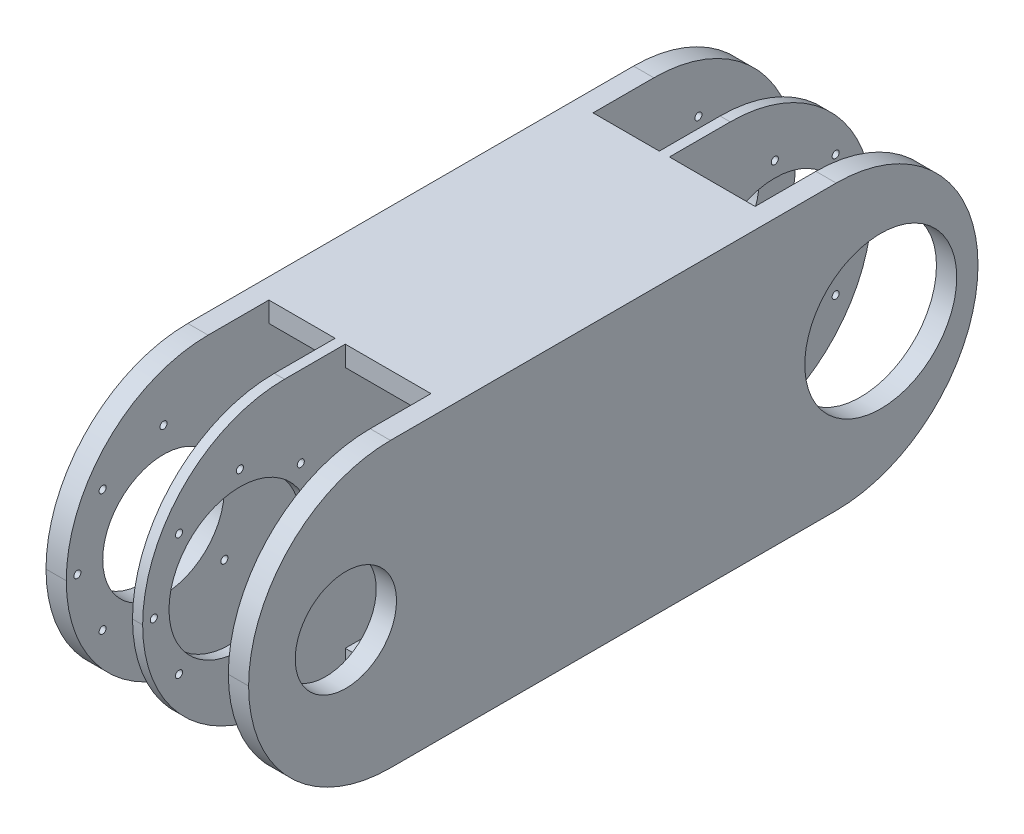
from build123d import *

# Parameters (mm, degrees)
SKETCH_1_W           = 42.3
SKETCH_1_H           = 10
EXTRUDE_3_DEPTH      = 240
SKETCH_2_W           = 42.3
SKETCH_2_H           = 140
CUT_EXTRUDE_1_DEPTH  = 100
SKETCH_3_W           = 42.7
SKETCH_3_H           = 240
EXTRUDE_4_DEPTH      = 140
CUT_EXTRUDE_2_REACH  = 287.139
SKETCH_4_W           = 32.7
SKETCH_4_H           = 120
SKETCH_7_W           = 32.7
SKETCH_7_H           = 140
CUT_EXTRUDE_6_DEPTH  = 100
FILLET_2_R           = 70
SKETCH_6_R           = 35
SKETCH_6_R_2         = 1.75
CUT_EXTRUDE_7_DEPTH  = 10
SKETCH_5_R           = 30
SKETCH_5_R_2         = 1.75
CUT_EXTRUDE_8_DEPTH  = 10
SKETCH_8_W           = 10
SKETCH_8_H           = 140
EXTRUDE_5_DEPTH      = 110
FILLET_4_R           = 60
SKETCH_17_R          = 25
CUT_EXTRUDE_13_DEPTH = 139
CUT_EXTRUDE_14_DEPTH = 110
SKETCH_19_R          = 37.5
CUT_EXTRUDE_15_DEPTH = 14


with BuildPart() as part:
    # 草图1 → 凸台-拉伸3 (new body)
    with BuildSketch(Plane.XY):
        with Locations((-15.094230769, 5.936538462)):
            Rectangle(SKETCH_1_W, SKETCH_1_H)
        Polygon((-36.244230769, 0.936538462), (-36.244230769, 10.936538462), (-41.244230769, 10.936538462), (-41.244230769, -129.063461538), (-36.244230769, -129.063461538), (-36.244230769, -119.063461538), align=None)
        Polygon((16.055769231, 10.936538462), (6.055769231, 10.936538462), (6.055769231, 0.936538462), (6.055769231, -119.063461538), (6.055769231, -129.063461538), (16.055769231, -129.063461538), align=None)
        with Locations((-15.094230769, -124.063461538)):
            Rectangle(SKETCH_1_W, SKETCH_1_H)
    extrude(amount=EXTRUDE_3_DEPTH)

    # 草图2 → 切除-拉伸1 (cut)
    with BuildSketch(Plane.XY.offset(240)):
        with Locations((-15.094230769, -59.063461538)):
            Rectangle(SKETCH_2_W, SKETCH_2_H)
    extrude(amount=-CUT_EXTRUDE_1_DEPTH, mode=Mode.SUBTRACT)

    # 草图3 → 凸台-拉伸4 (add)
    with BuildSketch(Plane.XZ.offset(129.063461538)):
        with Locations((-62.594230769, 120)):
            Rectangle(SKETCH_3_W, SKETCH_3_H)
    extrude(amount=-EXTRUDE_4_DEPTH)

    # 草图4 → 切除-拉伸2 (cut, up to next)
    with BuildSketch(Plane.XY.offset(240), mode=Mode.PRIVATE) as cut_extrude_2_sk1:
        with Locations((-57.594230769, -59.063461538)):
            Rectangle(SKETCH_4_W, SKETCH_4_H)
    cut_extrude_2_tool1 = extrude(cut_extrude_2_sk1.sketch, amount=-CUT_EXTRUDE_2_REACH, mode=Mode.PRIVATE) & part.part
    add(cut_extrude_2_tool1.solids().sort_by_distance((-57.594231, -59.063462, 240))[0], mode=Mode.SUBTRACT)

    # 草图7 → 切除-拉伸6 (cut)
    with BuildSketch(Plane.XY.offset(240)):
        with Locations((-57.594230769, -59.063461538)):
            Rectangle(SKETCH_7_W, SKETCH_7_H)
    extrude(amount=-CUT_EXTRUDE_6_DEPTH, mode=Mode.SUBTRACT)

    # 圆角2
    fillet_2_edges = [part.edges().sort_by_distance(p)[0] for p in [
        (11.055769231, 10.936538462, 240),
        (-38.744230769, 10.936538462, 240),
        (-78.944230769, 10.936538462, 240),
        (11.055769231, -129.063461538, 240),
        (-38.744230769, -129.063461538, 240),
        (-78.944230769, -129.063461538, 240),
    ]]
    fillet(fillet_2_edges, radius=FILLET_2_R - 0.0001)  # a hair under: the kernel refuses the full size

    # 草图6 → 切除-拉伸7 (cut)
    with BuildSketch(Plane.ZY.offset(41.244230769)):
        with Locations((192, -59.063461538)):
            Circle(SKETCH_6_R)
        with Locations((149.5, -59.063461538)):
            Circle(SKETCH_6_R_2)
        with Locations((161.9479618, -29.011423338)):
            Circle(SKETCH_6_R_2)
        with Locations((192, -16.563461538)):
            Circle(SKETCH_6_R_2)
        with Locations((222.0520382, -29.011423338)):
            Circle(SKETCH_6_R_2)
        with Locations((234.5, -59.063461538)):
            Circle(SKETCH_6_R_2)
        with Locations((222.0520382, -89.115499739)):
            Circle(SKETCH_6_R_2)
        with Locations((192, -101.563461538)):
            Circle(SKETCH_6_R_2)
        with Locations((161.9479618, -89.115499739)):
            Circle(SKETCH_6_R_2)
    extrude(amount=-CUT_EXTRUDE_7_DEPTH, mode=Mode.SUBTRACT)

    # 草图5 → 切除-拉伸8 (cut)
    with BuildSketch(Plane.ZY.offset(83.944230769)):
        with Locations((192, -59.063461538)):
            Circle(SKETCH_5_R)
        with Locations((161.9479618, -29.011423338)):
            Circle(SKETCH_5_R_2)
        with Locations((149.5, -59.063461538)):
            Circle(SKETCH_5_R_2)
        with Locations((161.9479618, -89.115499739)):
            Circle(SKETCH_5_R_2)
        with Locations((192, -101.563461538)):
            Circle(SKETCH_5_R_2)
        with Locations((222.0520382, -89.115499739)):
            Circle(SKETCH_5_R_2)
        with Locations((234.5, -59.063461538)):
            Circle(SKETCH_5_R_2)
        with Locations((222.0520382, -29.011423338)):
            Circle(SKETCH_5_R_2)
        with Locations((192, -16.563461538)):
            Circle(SKETCH_5_R_2)
    extrude(amount=-CUT_EXTRUDE_8_DEPTH, mode=Mode.SUBTRACT)

    # 草图8 → 凸台-拉伸5 (add)
    with BuildSketch(Plane(origin=(0, 0, 0), x_dir=(-1, 0, 0), z_dir=(0, 0, -1))):
        with Locations((-11.055769231, -59.063461538)):
            Rectangle(SKETCH_8_W, SKETCH_8_H)
        with Locations((78.944230769, -59.063461538)):
            Rectangle(SKETCH_8_W, SKETCH_8_H)
    extrude(amount=EXTRUDE_5_DEPTH)

    # 圆角4
    fillet_4_edges = [part.edges().sort_by_distance(p)[0] for p in [
        (11.055769231, 10.936538462, -110),
        (11.055769231, -129.063461538, -110),
        (-78.944230769, -129.063461538, -110),
        (-78.944230769, 10.936538462, -110),
    ]]
    fillet(fillet_4_edges, radius=FILLET_4_R)

    # 草图17 → 切除-拉伸13 (cut)
    with BuildSketch(Plane.ZY.offset(83.944230769)):
        with Locations(Location((192, -59.063461538, 0), (0, 0, 180))):
            Circle(SKETCH_17_R)
    extrude(amount=-CUT_EXTRUDE_13_DEPTH, mode=Mode.SUBTRACT)

    # 草图18 → 切除-拉伸14 (cut)
    with BuildSketch(Plane(origin=(16.055769231, 0, 0), x_dir=(0, 0, -1), z_dir=(1, 0, 0))):
        with BuildLine():
            Line((-60, 86.355512133), (-60, 10.936538462))
            Line((-60, 10.936538462), (50, 10.936538462))
            ThreePointArc((50, 10.936538462), (92.426406871, -6.637054667), (110, -49.063461538))
            Line((110, -49.063461538), (110, -69.063461538))
            ThreePointArc((110, -69.063461538), (92.426406871, -111.48986841), (50, -129.063461538))
            Line((50, -129.063461538), (-60, -129.063461538))
            Line((-60, -129.063461538), (-60, -152.364477091))
            Line((-60, -152.364477091), (264.503295558, -152.364477091))
            Line((264.503295558, -152.364477091), (264.503295558, 86.355512133))
            Line((264.503295558, 86.355512133), (-60, 86.355512133))
        make_face()
        with BuildLine():
            Line((50, 10.936538462), (-60, 10.936538462))
            Line((-60, 10.936538462), (-60, -129.063461538))
            Line((-60, -129.063461538), (50, -129.063461538))
            ThreePointArc((50, -129.063461538), (92.426406871, -111.48986841), (110, -69.063461538))
            Line((110, -69.063461538), (110, -49.063461538))
            ThreePointArc((110, -49.063461538), (92.426406871, -6.637054667), (50, 10.936538462))
        make_face()
    extrude(amount=-CUT_EXTRUDE_14_DEPTH, mode=Mode.SUBTRACT)

    # 镜向2: part across plane


with BuildPart() as part_1:
    add(part.part)
    add(part.part.mirror(Plane(origin=(-93.944230769, 0, 60), x_dir=(1, 0, 0), z_dir=(0, 0, 1))))

    # 草图19 → 切除-拉伸15 (cut)
    with BuildSketch(Plane(origin=(16.055769231, 0, 0), x_dir=(0, 0, -1), z_dir=(1, 0, 0))):
        with Locations((72, -59.063461538)):
            Circle(SKETCH_19_R)
    extrude(amount=-CUT_EXTRUDE_15_DEPTH, mode=Mode.SUBTRACT)


solid = part_1.part
